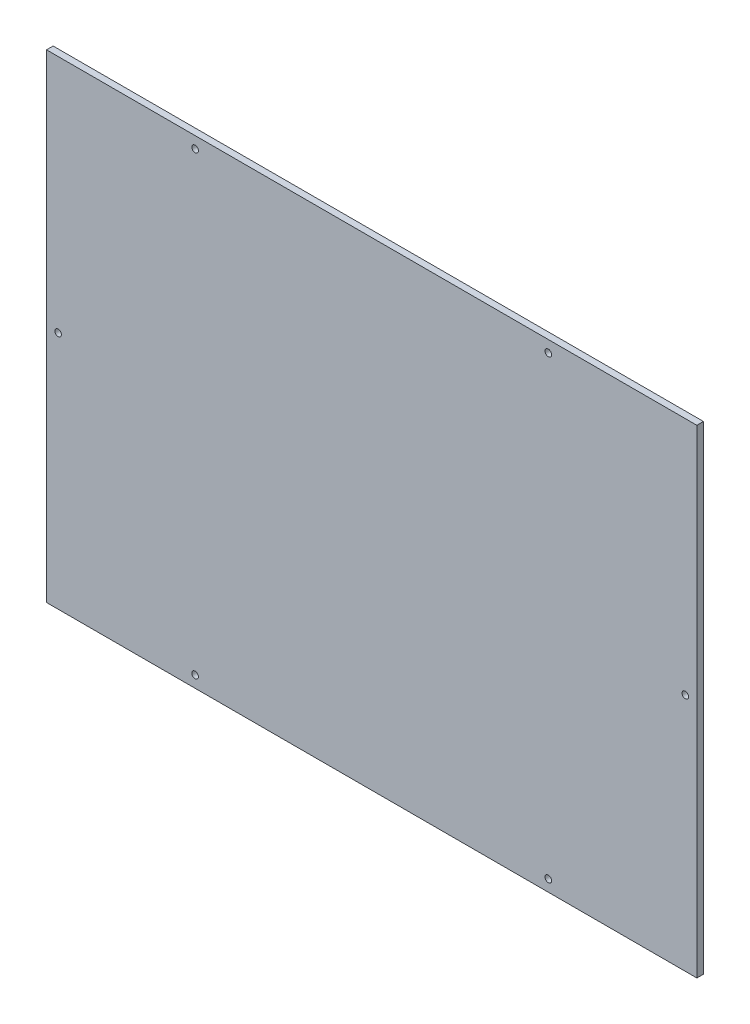
from build123d import *

# Parameters (mm, degrees)
SCHIZZO1_W                   = 394
SCHIZZO1_H                   = 290
SCHIZZO1_R                   = 2
ESTRUSIONE_ESTRUSIONE1_DEPTH = 4


with BuildPart() as part:
    # Schizzo1 → Estrusione-Estrusione1 (new body)
    with BuildSketch(Plane.XY):
        with Locations((-197, 145)):
            Rectangle(SCHIZZO1_W, SCHIZZO1_H)
        with Locations((-90, 283)):
            Circle(SCHIZZO1_R, mode=Mode.SUBTRACT)
        with Locations((-7, 145)):
            Circle(SCHIZZO1_R, mode=Mode.SUBTRACT)
        with Locations((-304, 283)):
            Circle(SCHIZZO1_R, mode=Mode.SUBTRACT)
        with Locations((-387, 145)):
            Circle(SCHIZZO1_R, mode=Mode.SUBTRACT)
        with Locations((-304, 7)):
            Circle(SCHIZZO1_R, mode=Mode.SUBTRACT)
        with Locations((-90, 7)):
            Circle(SCHIZZO1_R, mode=Mode.SUBTRACT)
    extrude(amount=ESTRUSIONE_ESTRUSIONE1_DEPTH)


solid = part.part
